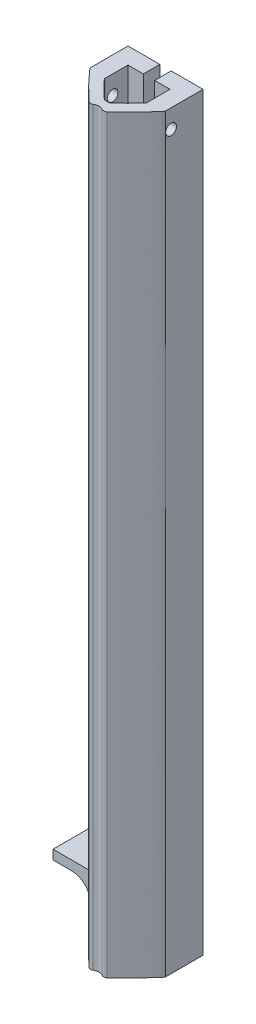
from build123d import *

# Parameters (mm, degrees)
SKETCH1_W           = 20
SKETCH1_H           = 20
SKETCH1_W_2         = 11.2
SKETCH1_H_2         = 11.2
BOSS_EXTRUDE1_DEPTH = 200
SKETCH2_R           = 1.45
CUT_EXTRUDE1_DEPTH  = 202.990098767
FILLET3_SIZE        = 5
FILLET4_SIZE        = 10
SKETCH4_R           = 2.25
CUT_EXTRUDE3_DEPTH  = 202.990098886
FILLET6_R           = 1
SKETCH5_W           = 3
SKETCH5_H           = 20
CUT_EXTRUDE4_DEPTH  = 10
FILLET7_START       = 8.5
FILLET7_DEPTH       = 3
SKETCH7_R           = 0.5
CUT_EXTRUDE6_DEPTH  = 5
SKETCH8_W           = 10
SKETCH8_H           = 2.5
BOSS_EXTRUDE2_DEPTH = 10
FILLET8_R           = 5


with BuildPart() as part:
    # Sketch1 → Boss-Extrude1 (new body)
    with BuildSketch(Plane(origin=(0, 0, 0), x_dir=(1, 0, 0), z_dir=(0, 1, 0))):
        with Locations((10, -10)):
            Rectangle(SKETCH1_W, SKETCH1_H)
        with Locations((10, -10)):
            Rectangle(SKETCH1_W_2, SKETCH1_H_2, mode=Mode.SUBTRACT)
    extrude(amount=BOSS_EXTRUDE1_DEPTH)

    # Sketch2 → Cut-Extrude1 (cut, through all)
    with BuildSketch(Plane.ZY):
        with Locations((8.5, 195)):
            Circle(SKETCH2_R)
    extrude(amount=-CUT_EXTRUDE1_DEPTH, mode=Mode.SUBTRACT)

    # Fillet3
    # a fillet whose section is not a circle: 5 mm, written as the material it adds along each edge
    with BuildSketch(Plane(origin=(4.4, 0, 15.6), x_dir=(1, 0, 0), z_dir=(0, 1, 0))) as fillet3_piece_1:
        with BuildLine():
            Bezier((FILLET3_SIZE, 0), (0, 0), (0, FILLET3_SIZE), weights=[1, 0.052631579, 1])
            Line((0, FILLET3_SIZE), (0, 0))
            Line((0, 0), (FILLET3_SIZE, 0))
        make_face()
    extrude(amount=200)
    with BuildSketch(Plane(origin=(15.6, 0, 15.6), x_dir=(-1, 0, 0), z_dir=(0, 1, 0))) as fillet3_piece_2:
        with BuildLine():
            Bezier((FILLET3_SIZE, 0), (0, 0), (0, -FILLET3_SIZE), weights=[1, 0.052631579, 1])
            Line((0, -FILLET3_SIZE), (0, 0))
            Line((0, 0), (FILLET3_SIZE, 0))
        make_face()
    extrude(amount=200)

    # Fillet4
    # a fillet whose section is not a circle: 10 mm, written as the material it takes off along each edge
    with BuildSketch(Plane(origin=(0, -25, 20), x_dir=(0, 0, -1), z_dir=(0, 1, 0)), Plane(origin=(20, -25, 20), x_dir=(-1, 0, 0), z_dir=(0, 1, 0))) as fillet4_piece_1:
        with BuildLine():
            Bezier((FILLET4_SIZE, 0), (0, 0), (0, -FILLET4_SIZE), weights=[1, 0.052631579, 1])
            Line((0, -FILLET4_SIZE), (0, 0))
            Line((0, 0), (FILLET4_SIZE, 0))
        make_face()
    extrude(amount=250, mode=Mode.SUBTRACT)

    # Sketch4 → Cut-Extrude3 (cut, through all)
    with BuildSketch(Plane(origin=(0, 200, 0), x_dir=(1, 0, 0), z_dir=(0, 1, 0))):
        with Locations((10, -20)):
            Circle(SKETCH4_R)
    extrude(amount=-CUT_EXTRUDE3_DEPTH, mode=Mode.SUBTRACT)

    # Fillet6
    fillet6_edges = [part.edges().sort_by_distance(p)[0] for p in [
        (11.759792875, 100, 18.597991071),
        (8.240207125, 100, 18.597991071),
    ]]
    fillet(fillet6_edges, radius=FILLET6_R)

    # Sketch5 → Cut-Extrude4 (cut)
    with BuildSketch(Plane(origin=(0, 0, 0), x_dir=(-1, 0, 0), z_dir=(0, 0, -1))):
        with Locations((-10, 190)):
            Rectangle(SKETCH5_W, SKETCH5_H)
    extrude(amount=-CUT_EXTRUDE4_DEPTH, mode=Mode.SUBTRACT)

    # Fillet7: read off the stored shape, not the designer's step
    # Fillet7 outline → Fillet7 (cut)
    with BuildSketch(Plane.YZ.offset(FILLET7_START)):
        with BuildLine():
            Line((180, 0), (180, 2))
            add(Edge.make_bspline(
                [(180, 2), (180, 0), (178, 0)],
                knots=[0, 0, 0, 1, 1, 1], degree=2, weights=[1, 0.052631579, 1]))
            Line((178, 0), (180, 0))
        make_face()
    extrude(amount=FILLET7_DEPTH, mode=Mode.SUBTRACT)

    # Sketch7 → Cut-Extrude6 (cut)
    with BuildSketch(Plane(origin=(0, 0, 0), x_dir=(-1, 0, 0), z_dir=(0, -1, 0))):
        with Locations(Location((-10, -16.7, 0), (0, 0, 90))):
            Circle(SKETCH7_R)
    extrude(amount=-CUT_EXTRUDE6_DEPTH, mode=Mode.SUBTRACT)

    # Sketch8 → Boss-Extrude2 (add)
    with BuildSketch(Plane.ZY):
        with Locations((5, 13.25)):
            Rectangle(SKETCH8_W, SKETCH8_H)
    extrude(amount=BOSS_EXTRUDE2_DEPTH)

    # Fillet8
    fillet8_edges = [part.edges().sort_by_distance(p)[0] for p in [
        (0, 12, 5),
    ]]
    fillet(fillet8_edges, radius=FILLET8_R)


solid = part.part
